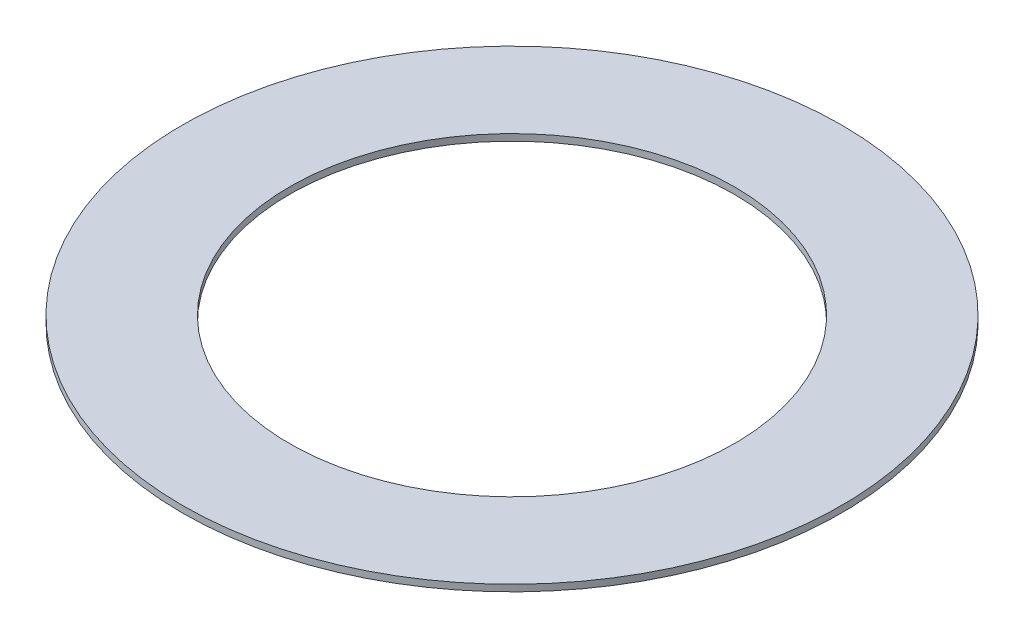
from build123d import *

# Parameters (mm, degrees)
SKETCH_1_W = 3.25
SKETCH_1_H = 0.2


with BuildPart() as part:
    # 草图1 → 旋转1 (revolve)
    with BuildSketch(Plane.XY):
        with Locations((8.375, 0.1)):
            Rectangle(SKETCH_1_W, SKETCH_1_H)
    revolve(axis=Axis((0, 0.2, 0), (0, -1, 0)))


solid = part.part
